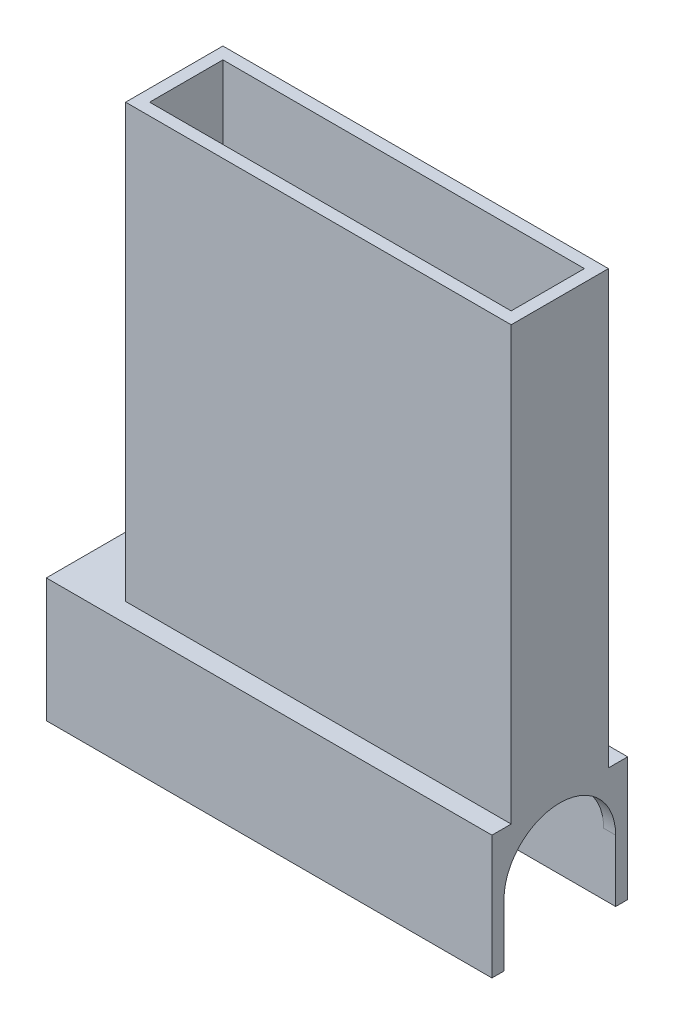
from build123d import *

# Parameters (mm, degrees)
SKETCH1_W           = 32.1
SKETCH1_H           = 8.1
BOSS_EXTRUDE3_DEPTH = 36
SKETCH3_W           = 37.1
SKETCH3_H           = 11.3
BOSS_EXTRUDE4_DEPTH = 10.3
SKETCH4_W           = 35.1
SKETCH4_H           = 9.3
CUT_EXTRUDE2_DEPTH  = 9.3
SKETCH5_W           = 30.1
SKETCH5_H           = 6.1
CUT_EXTRUDE3_DEPTH  = 52.173381753
CUT_EXTRUDE4_DEPTH  = 53.003197017


with BuildPart() as part:
    # Sketch1 → Boss-Extrude3 (new body)
    with BuildSketch(Plane(origin=(0, 0, 0), x_dir=(1, 0, 0), z_dir=(0, 1, 0))):
        Rectangle(SKETCH1_W, SKETCH1_H)
    extrude(amount=BOSS_EXTRUDE3_DEPTH)

    # Sketch3 → Boss-Extrude4 (add)
    with BuildSketch(Plane.XZ):
        with Locations((-2.5, 0)):
            Rectangle(SKETCH3_W, SKETCH3_H)
    extrude(amount=BOSS_EXTRUDE4_DEPTH)

    # Sketch4 → Cut-Extrude2 (cut)
    with BuildSketch(Plane.XZ.offset(10.3)):
        with Locations((-2.5, 0)):
            Rectangle(SKETCH4_W, SKETCH4_H)
    extrude(amount=-CUT_EXTRUDE2_DEPTH, mode=Mode.SUBTRACT)

    # Sketch5 → Cut-Extrude3 (cut, through all)
    with BuildSketch(Plane(origin=(0, 36, 0), x_dir=(1, 0, 0), z_dir=(0, 1, 0))):
        Rectangle(SKETCH5_W, SKETCH5_H)
    extrude(amount=-CUT_EXTRUDE3_DEPTH, mode=Mode.SUBTRACT)

    # Sketch7 → Cut-Extrude4 (cut, through all)
    with BuildSketch(Plane(origin=(16.05, 0, 0), x_dir=(0, 0, -1), z_dir=(1, 0, 0))):
        with BuildLine():
            Line((4.65, -5.15), (4.65, -10.3))
            Line((4.65, -10.3), (-4.65, -10.3))
            Line((-4.65, -10.3), (-4.65, -5.15))
            ThreePointArc((-4.65, -5.15), (0, -0.5), (4.65, -5.15))
        make_face()
    extrude(amount=-CUT_EXTRUDE4_DEPTH, mode=Mode.SUBTRACT)


solid = part.part
